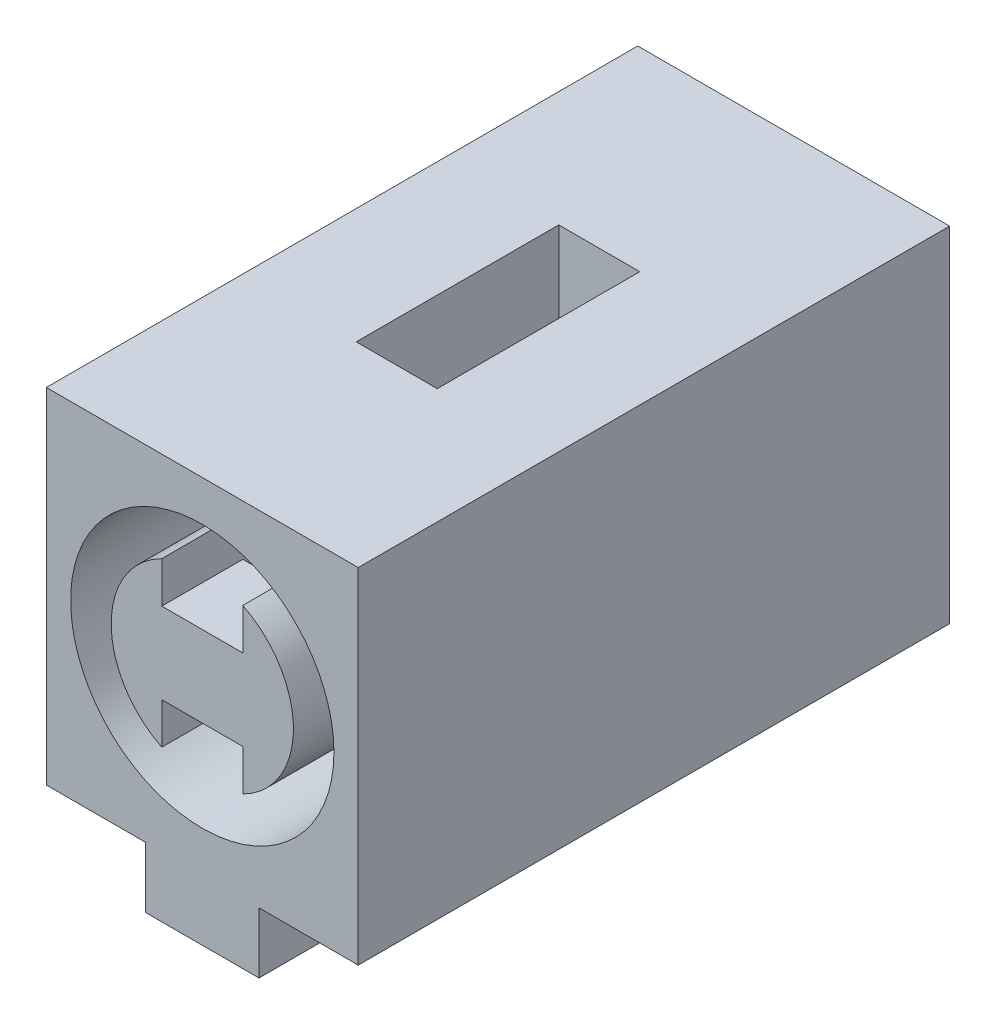
from build123d import *

# Parameters (mm, degrees)
SZKIC1_W                    = 7.7
SZKIC1_H                    = 14.6
DODANIE_WYCI_GNI_CIE1_DEPTH = 8.5
SZKIC2_W                    = 2
SZKIC2_H                    = 5
WYTNIJ_WYCI_GNI_CIE1_DEPTH  = 10
SZKIC7_R                    = 3.25
SZKIC7_R_2                  = 2.25
WYTNIJ_WYCI_GNI_CIE4_DEPTH  = 3.8
SZKIC10_W                   = 2
SZKIC10_H                   = 6.184658438
WYTNIJ_WYCI_GNI_CIE6_DEPTH  = 3.8
SZKIC12_W                   = 2
SZKIC12_H                   = 2
DODANIE_WYCI_GNI_CIE4_DEPTH = 2
SZKIC15_W                   = 2.8
SZKIC15_H                   = 4.8
DODANIE_WYCI_GNI_CIE6_DEPTH = 1.5


with BuildPart() as part:
    # Szkic1 → Dodanie-wyciągnięcie1 (new body)
    with BuildSketch(Plane(origin=(0, 0, 0), x_dir=(1, 0, 0), z_dir=(0, 1, 0))):
        with Locations((3.85, 7.3)):
            Rectangle(SZKIC1_W, SZKIC1_H)
    extrude(amount=DODANIE_WYCI_GNI_CIE1_DEPTH)

    # Szkic2 → Wytnij-wyciągnięcie1 (cut)
    with BuildSketch(Plane.XZ):
        with Locations((3.85, -7.3)):
            Rectangle(SZKIC2_W, SZKIC2_H)
    extrude(amount=-WYTNIJ_WYCI_GNI_CIE1_DEPTH, mode=Mode.SUBTRACT)

    # Szkic7 → Wytnij-wyciągnięcie4 (cut)
    with BuildSketch(Plane.XY):
        with Locations((3.85, 4.25)):
            Circle(SZKIC7_R)
        with Locations((3.85, 4.25)):
            Circle(SZKIC7_R_2, mode=Mode.SUBTRACT)
    extrude(amount=-WYTNIJ_WYCI_GNI_CIE4_DEPTH, mode=Mode.SUBTRACT)

    # Szkic10 → Wytnij-wyciągnięcie6 (cut)
    with BuildSketch(Plane.XY):
        with Locations((3.85, 4.25)):
            Rectangle(SZKIC10_W, SZKIC10_H)
    extrude(amount=-WYTNIJ_WYCI_GNI_CIE6_DEPTH, mode=Mode.SUBTRACT)

    # Szkic12 → Dodanie-wyciągnięcie4 (add)
    with BuildSketch(Plane(origin=(2.85, 0, 0), x_dir=(0, 0, -1), z_dir=(1, 0, 0))):
        with Locations((1, 4.25)):
            Rectangle(SZKIC12_W, SZKIC12_H)
    extrude(amount=DODANIE_WYCI_GNI_CIE4_DEPTH)

    # Szkic15 → Dodanie-wyciągnięcie6 (add)
    with BuildSketch(Plane.XZ):
        with Locations((3.85, -2.4)):
            Rectangle(SZKIC15_W, SZKIC15_H)
        with Locations((3.85, -12.2)):
            Rectangle(SZKIC15_W, SZKIC15_H)
    extrude(amount=DODANIE_WYCI_GNI_CIE6_DEPTH)


solid = part.part
